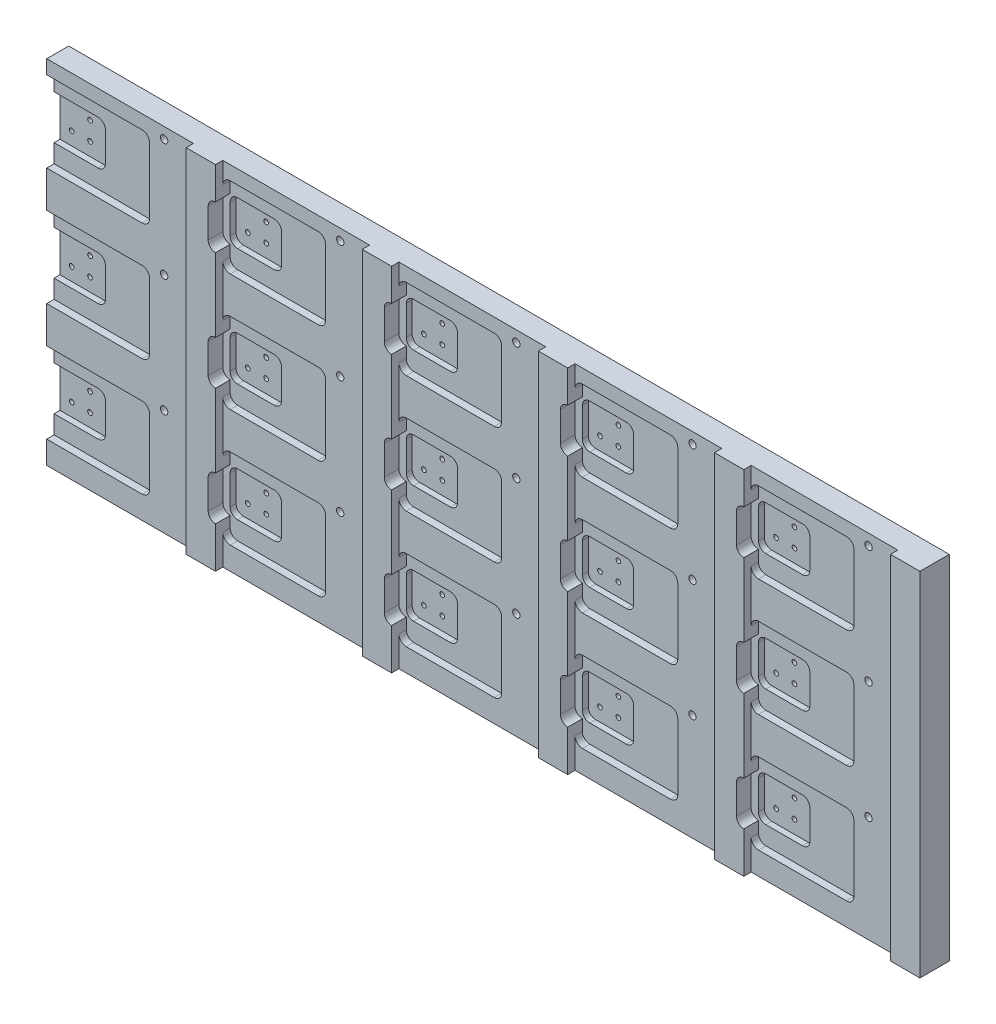
from build123d import *

# Parameters (mm, degrees)
SKETCH1_W              = 762
SKETCH1_H              = 304.8
BOSS_EXTRUDE1_DEPTH    = 25.4
SKETCH4_W              = 127
SKETCH4_H              = 304.8
CUT_EXTRUDE3_DEPTH     = 6.35
SKETCH3_R              = 3.175
CUT_EXTRUDE2_DEPTH     = 15.24
SKETCH5_W              = 88.9
SKETCH5_H              = 69.85
CUT_EXTRUDE4_DEPTH     = 6.35
FILLET1_R              = 6.35
SKETCH6_W              = 44.45
SKETCH6_H              = 38.1
CUT_EXTRUDE5_DEPTH     = 5.08
FILLET2_R              = 6.35
LPATTERN1_COUNT        = 3
LPATTERN1_PITCH        = 101.6
FILLET1_OF_LPATTERN1_R = 6.35
FILLET2_OF_LPATTERN1_R = 6.35
LPATTERN2_START        = 12.7
LPATTERN2_OUTLINE_R    = 3.175
LPATTERN2_DEPTH        = 6.35
LPATTERN2_START_2      = 7.62
LPATTERN2_2_DEPTH      = 5.08
LPATTERN2_START_3      = 10.16
LPATTERN2_3_OUTLINE_R  = 3.175
LPATTERN2_3_DEPTH      = 2.54
FILLET3_R              = 6.35
F_10_32_TAPPED_HOLE1_D = 4.0386
LPATTERN5_COUNT        = 5
LPATTERN5_PITCH        = 152.4
LPATTERN5_COUNT_DIR2   = 3
LPATTERN5_PITCH_DIR2   = 101.6
CUT_EXTRUDE6_START     = -12.7
CUT_EXTRUDE6_DEPTH     = 12.7
LPATTERN6_COUNT        = 4
LPATTERN6_PITCH        = 152.4
LPATTERN6_COUNT_DIR2   = 3
LPATTERN6_PITCH_DIR2   = 101.6


# Read off the part's stored shape, not the designer's step: LPattern2
with BuildPart() as part:
    # Sketch1 → Boss-Extrude1 (new body)
    with BuildSketch(Plane.XY):
        with Locations((381, 152.4)):
            Rectangle(SKETCH1_W, SKETCH1_H)
    extrude(amount=BOSS_EXTRUDE1_DEPTH)

    # Sketch4 → Cut-Extrude3 (cut)
    with BuildSketch(Plane.XY.offset(25.4)):
        with Locations((63.5, 152.4)):
            Rectangle(SKETCH4_W, SKETCH4_H)
        with Locations((215.9, 152.4)):
            Rectangle(SKETCH4_W, SKETCH4_H)
        with Locations((368.3, 152.4)):
            Rectangle(SKETCH4_W, SKETCH4_H)
        with Locations((520.7, 152.4)):
            Rectangle(SKETCH4_W, SKETCH4_H)
        with Locations((673.1, 152.4)):
            Rectangle(SKETCH4_W, SKETCH4_H)
    extrude(amount=-CUT_EXTRUDE3_DEPTH, mode=Mode.SUBTRACT)

    # Sketch3 → Cut-Extrude2 (cut)
    with BuildSketch(Plane.XY.offset(25.4)):
        with Locations((101.6, 295.275)):
            Circle(SKETCH3_R)
    cut_extrude2 = extrude(amount=-CUT_EXTRUDE2_DEPTH, mode=Mode.SUBTRACT)

    # Sketch5 → Cut-Extrude4 (cut)
    with BuildSketch(Plane.XY.offset(19.05)):
        with Locations((44.45, 257.81)):
            Rectangle(SKETCH5_W, SKETCH5_H)
    cut_extrude4 = extrude(amount=-CUT_EXTRUDE4_DEPTH, mode=Mode.SUBTRACT)

    # Fillet1
    fillet1_edges = [part.edges().sort_by_distance(p)[0] for p in [
        (88.9, 292.735, 15.875),
        (88.9, 222.885, 15.875),
    ]]
    fillet(fillet1_edges, radius=FILLET1_R)

    # Sketch6 → Cut-Extrude5 (cut)
    with BuildSketch(Plane.XY.offset(12.7)):
        with Locations((22.225, 257.81)):
            Rectangle(SKETCH6_W, SKETCH6_H)
    cut_extrude5 = extrude(amount=-CUT_EXTRUDE5_DEPTH, mode=Mode.SUBTRACT)

    # Fillet2
    fillet2_edges = [part.edges().sort_by_distance(p)[0] for p in [
        (44.45, 276.86, 10.16),
        (44.45, 238.76, 10.16),
    ]]
    fillet(fillet2_edges, radius=FILLET2_R)

    # LPattern1: Cut-Extrude2, Cut-Extrude4, Cut-Extrude5 ×3
    with Locations(*[(0, -i * LPATTERN1_PITCH, 0) for i in range(1, LPATTERN1_COUNT)]):
        add(cut_extrude2, mode=Mode.SUBTRACT)
        add(cut_extrude4, mode=Mode.SUBTRACT)
        add(cut_extrude5, mode=Mode.SUBTRACT)

    # Fillet1 of LPattern1
    fillet1_of_lpattern1_edges = [part.edges().sort_by_distance(p)[0] for p in [
        (88.9, 191.135, 15.875),
        (88.9, 121.285, 15.875),
        (88.9, 89.535, 15.875),
        (88.9, 19.685, 15.875),
    ]]
    fillet(fillet1_of_lpattern1_edges, radius=FILLET1_OF_LPATTERN1_R)

    # Fillet2 of LPattern1
    fillet2_of_lpattern1_edges = [part.edges().sort_by_distance(p)[0] for p in [
        (44.45, 175.26, 10.16),
        (44.45, 137.16, 10.16),
        (44.45, 73.66, 10.16),
        (44.45, 35.56, 10.16),
    ]]
    fillet(fillet2_of_lpattern1_edges, radius=FILLET2_OF_LPATTERN1_R)

    # LPattern2 outline → LPattern2 (cut)
    with BuildSketch(Plane.XY.offset(LPATTERN2_START)):
        with BuildLine():
            Line((234.95, 292.735), (152.4, 292.735))
            Line((152.4, 292.735), (152.4, 222.885))
            Line((152.4, 222.885), (234.95, 222.885))
            ThreePointArc((234.95, 222.885), (239.440128061, 224.744871939), (241.3, 229.235))
            Line((241.3, 229.235), (241.3, 286.385))
            ThreePointArc((241.3, 286.385), (239.440128061, 290.875128061), (234.95, 292.735))
        make_face()
        with BuildLine():
            Line((234.95, 89.535), (152.4, 89.535))
            Line((152.4, 89.535), (152.4, 19.685))
            Line((152.4, 19.685), (234.95, 19.685))
            ThreePointArc((234.95, 19.685), (239.440128061, 21.544871939), (241.3, 26.035))
            Line((241.3, 26.035), (241.3, 83.185))
            ThreePointArc((241.3, 83.185), (239.440128061, 87.675128061), (234.95, 89.535))
        make_face()
        with BuildLine():
            Line((234.95, 191.135), (152.4, 191.135))
            Line((152.4, 191.135), (152.4, 121.285))
            Line((152.4, 121.285), (234.95, 121.285))
            ThreePointArc((234.95, 121.285), (239.440128061, 123.144871939), (241.3, 127.635))
            Line((241.3, 127.635), (241.3, 184.785))
            ThreePointArc((241.3, 184.785), (239.440128061, 189.275128061), (234.95, 191.135))
        make_face()
        with BuildLine():
            Line((387.35, 292.735), (304.8, 292.735))
            Line((304.8, 292.735), (304.8, 222.885))
            Line((304.8, 222.885), (387.35, 222.885))
            ThreePointArc((387.35, 222.885), (391.840128061, 224.744871939), (393.7, 229.235))
            Line((393.7, 229.235), (393.7, 286.385))
            ThreePointArc((393.7, 286.385), (391.840128061, 290.875128061), (387.35, 292.735))
        make_face()
        with BuildLine():
            Line((387.35, 89.535), (304.8, 89.535))
            Line((304.8, 89.535), (304.8, 19.685))
            Line((304.8, 19.685), (387.35, 19.685))
            ThreePointArc((387.35, 19.685), (391.840128061, 21.544871939), (393.7, 26.035))
            Line((393.7, 26.035), (393.7, 83.185))
            ThreePointArc((393.7, 83.185), (391.840128061, 87.675128061), (387.35, 89.535))
        make_face()
        with BuildLine():
            Line((387.35, 191.135), (304.8, 191.135))
            Line((304.8, 191.135), (304.8, 121.285))
            Line((304.8, 121.285), (387.35, 121.285))
            ThreePointArc((387.35, 121.285), (391.840128061, 123.144871939), (393.7, 127.635))
            Line((393.7, 127.635), (393.7, 184.785))
            ThreePointArc((393.7, 184.785), (391.840128061, 189.275128061), (387.35, 191.135))
        make_face()
        with BuildLine():
            Line((539.75, 292.735), (457.2, 292.735))
            Line((457.2, 292.735), (457.2, 222.885))
            Line((457.2, 222.885), (539.75, 222.885))
            ThreePointArc((539.75, 222.885), (544.240128061, 224.744871939), (546.1, 229.235))
            Line((546.1, 229.235), (546.1, 286.385))
            ThreePointArc((546.1, 286.385), (544.240128061, 290.875128061), (539.75, 292.735))
        make_face()
        with BuildLine():
            Line((539.75, 89.535), (457.2, 89.535))
            Line((457.2, 89.535), (457.2, 19.685))
            Line((457.2, 19.685), (539.75, 19.685))
            ThreePointArc((539.75, 19.685), (544.240128061, 21.544871939), (546.1, 26.035))
            Line((546.1, 26.035), (546.1, 83.185))
            ThreePointArc((546.1, 83.185), (544.240128061, 87.675128061), (539.75, 89.535))
        make_face()
        with BuildLine():
            Line((539.75, 191.135), (457.2, 191.135))
            Line((457.2, 191.135), (457.2, 121.285))
            Line((457.2, 121.285), (539.75, 121.285))
            ThreePointArc((539.75, 121.285), (544.240128061, 123.144871939), (546.1, 127.635))
            Line((546.1, 127.635), (546.1, 184.785))
            ThreePointArc((546.1, 184.785), (544.240128061, 189.275128061), (539.75, 191.135))
        make_face()
        with BuildLine():
            Line((692.15, 292.735), (609.6, 292.735))
            Line((609.6, 292.735), (609.6, 222.885))
            Line((609.6, 222.885), (692.15, 222.885))
            ThreePointArc((692.15, 222.885), (696.640128061, 224.744871939), (698.5, 229.235))
            Line((698.5, 229.235), (698.5, 286.385))
            ThreePointArc((698.5, 286.385), (696.640128061, 290.875128061), (692.15, 292.735))
        make_face()
        with BuildLine():
            Line((692.15, 89.535), (609.6, 89.535))
            Line((609.6, 89.535), (609.6, 19.685))
            Line((609.6, 19.685), (692.15, 19.685))
            ThreePointArc((692.15, 19.685), (696.640128061, 21.544871939), (698.5, 26.035))
            Line((698.5, 26.035), (698.5, 83.185))
            ThreePointArc((698.5, 83.185), (696.640128061, 87.675128061), (692.15, 89.535))
        make_face()
        with BuildLine():
            Line((692.15, 191.135), (609.6, 191.135))
            Line((609.6, 191.135), (609.6, 121.285))
            Line((609.6, 121.285), (692.15, 121.285))
            ThreePointArc((692.15, 121.285), (696.640128061, 123.144871939), (698.5, 127.635))
            Line((698.5, 127.635), (698.5, 184.785))
            ThreePointArc((698.5, 184.785), (696.640128061, 189.275128061), (692.15, 191.135))
        make_face()
        with Locations((254, 295.275)):
            Circle(LPATTERN2_OUTLINE_R)
        with Locations((254, 193.675)):
            Circle(LPATTERN2_OUTLINE_R)
        with Locations((254, 92.075)):
            Circle(LPATTERN2_OUTLINE_R)
        with Locations((406.4, 295.275)):
            Circle(LPATTERN2_OUTLINE_R)
        with Locations((406.4, 193.675)):
            Circle(LPATTERN2_OUTLINE_R)
        with Locations((406.4, 92.075)):
            Circle(LPATTERN2_OUTLINE_R)
        with Locations((558.8, 295.275)):
            Circle(LPATTERN2_OUTLINE_R)
        with Locations((558.8, 193.675)):
            Circle(LPATTERN2_OUTLINE_R)
        with Locations((558.8, 92.075)):
            Circle(LPATTERN2_OUTLINE_R)
        with Locations((711.2, 295.275)):
            Circle(LPATTERN2_OUTLINE_R)
        with Locations((711.2, 193.675)):
            Circle(LPATTERN2_OUTLINE_R)
        with Locations((711.2, 92.075)):
            Circle(LPATTERN2_OUTLINE_R)
    extrude(amount=LPATTERN2_DEPTH, mode=Mode.SUBTRACT)

    # LPattern2 2 outline → LPattern2 2 (cut)
    with BuildSketch(Plane.XY.offset(LPATTERN2_START_2)):
        with BuildLine():
            Line((190.5, 276.86), (152.4, 276.86))
            Line((152.4, 276.86), (152.4, 238.76))
            Line((152.4, 238.76), (190.5, 238.76))
            ThreePointArc((190.5, 238.76), (194.990128061, 240.619871939), (196.85, 245.11))
            Line((196.85, 245.11), (196.85, 270.51))
            ThreePointArc((196.85, 270.51), (194.990128061, 275.000128061), (190.5, 276.86))
        make_face()
        with BuildLine():
            Line((190.5, 175.26), (152.4, 175.26))
            Line((152.4, 175.26), (152.4, 137.16))
            Line((152.4, 137.16), (190.5, 137.16))
            ThreePointArc((190.5, 137.16), (194.990128061, 139.019871939), (196.85, 143.51))
            Line((196.85, 143.51), (196.85, 168.91))
            ThreePointArc((196.85, 168.91), (194.990128061, 173.400128061), (190.5, 175.26))
        make_face()
        with BuildLine():
            Line((190.5, 73.66), (152.4, 73.66))
            Line((152.4, 73.66), (152.4, 35.56))
            Line((152.4, 35.56), (190.5, 35.56))
            ThreePointArc((190.5, 35.56), (194.990128061, 37.419871939), (196.85, 41.91))
            Line((196.85, 41.91), (196.85, 67.31))
            ThreePointArc((196.85, 67.31), (194.990128061, 71.800128061), (190.5, 73.66))
        make_face()
        with BuildLine():
            Line((342.9, 276.86), (304.8, 276.86))
            Line((304.8, 276.86), (304.8, 238.76))
            Line((304.8, 238.76), (342.9, 238.76))
            ThreePointArc((342.9, 238.76), (347.390128061, 240.619871939), (349.25, 245.11))
            Line((349.25, 245.11), (349.25, 270.51))
            ThreePointArc((349.25, 270.51), (347.390128061, 275.000128061), (342.9, 276.86))
        make_face()
        with BuildLine():
            Line((342.9, 175.26), (304.8, 175.26))
            Line((304.8, 175.26), (304.8, 137.16))
            Line((304.8, 137.16), (342.9, 137.16))
            ThreePointArc((342.9, 137.16), (347.390128061, 139.019871939), (349.25, 143.51))
            Line((349.25, 143.51), (349.25, 168.91))
            ThreePointArc((349.25, 168.91), (347.390128061, 173.400128061), (342.9, 175.26))
        make_face()
        with BuildLine():
            Line((342.9, 73.66), (304.8, 73.66))
            Line((304.8, 73.66), (304.8, 35.56))
            Line((304.8, 35.56), (342.9, 35.56))
            ThreePointArc((342.9, 35.56), (347.390128061, 37.419871939), (349.25, 41.91))
            Line((349.25, 41.91), (349.25, 67.31))
            ThreePointArc((349.25, 67.31), (347.390128061, 71.800128061), (342.9, 73.66))
        make_face()
        with BuildLine():
            Line((495.3, 276.86), (457.2, 276.86))
            Line((457.2, 276.86), (457.2, 238.76))
            Line((457.2, 238.76), (495.3, 238.76))
            ThreePointArc((495.3, 238.76), (499.790128061, 240.619871939), (501.65, 245.11))
            Line((501.65, 245.11), (501.65, 270.51))
            ThreePointArc((501.65, 270.51), (499.790128061, 275.000128061), (495.3, 276.86))
        make_face()
        with BuildLine():
            Line((495.3, 175.26), (457.2, 175.26))
            Line((457.2, 175.26), (457.2, 137.16))
            Line((457.2, 137.16), (495.3, 137.16))
            ThreePointArc((495.3, 137.16), (499.790128061, 139.019871939), (501.65, 143.51))
            Line((501.65, 143.51), (501.65, 168.91))
            ThreePointArc((501.65, 168.91), (499.790128061, 173.400128061), (495.3, 175.26))
        make_face()
        with BuildLine():
            Line((495.3, 73.66), (457.2, 73.66))
            Line((457.2, 73.66), (457.2, 35.56))
            Line((457.2, 35.56), (495.3, 35.56))
            ThreePointArc((495.3, 35.56), (499.790128061, 37.419871939), (501.65, 41.91))
            Line((501.65, 41.91), (501.65, 67.31))
            ThreePointArc((501.65, 67.31), (499.790128061, 71.800128061), (495.3, 73.66))
        make_face()
        with BuildLine():
            Line((647.7, 276.86), (609.6, 276.86))
            Line((609.6, 276.86), (609.6, 238.76))
            Line((609.6, 238.76), (647.7, 238.76))
            ThreePointArc((647.7, 238.76), (652.190128061, 240.619871939), (654.05, 245.11))
            Line((654.05, 245.11), (654.05, 270.51))
            ThreePointArc((654.05, 270.51), (652.190128061, 275.000128061), (647.7, 276.86))
        make_face()
        with BuildLine():
            Line((647.7, 175.26), (609.6, 175.26))
            Line((609.6, 175.26), (609.6, 137.16))
            Line((609.6, 137.16), (647.7, 137.16))
            ThreePointArc((647.7, 137.16), (652.190128061, 139.019871939), (654.05, 143.51))
            Line((654.05, 143.51), (654.05, 168.91))
            ThreePointArc((654.05, 168.91), (652.190128061, 173.400128061), (647.7, 175.26))
        make_face()
        with BuildLine():
            Line((647.7, 73.66), (609.6, 73.66))
            Line((609.6, 73.66), (609.6, 35.56))
            Line((609.6, 35.56), (647.7, 35.56))
            ThreePointArc((647.7, 35.56), (652.190128061, 37.419871939), (654.05, 41.91))
            Line((654.05, 41.91), (654.05, 67.31))
            ThreePointArc((654.05, 67.31), (652.190128061, 71.800128061), (647.7, 73.66))
        make_face()
    extrude(amount=LPATTERN2_2_DEPTH, mode=Mode.SUBTRACT)

    # LPattern2 3 outline → LPattern2 3 (cut)
    with BuildSketch(Plane.XY.offset(LPATTERN2_START_3)):
        with Locations((254, 295.275)):
            Circle(LPATTERN2_3_OUTLINE_R)
        with Locations((254, 193.675)):
            Circle(LPATTERN2_3_OUTLINE_R)
        with Locations((254, 92.075)):
            Circle(LPATTERN2_3_OUTLINE_R)
        with Locations((406.4, 295.275)):
            Circle(LPATTERN2_3_OUTLINE_R)
        with Locations((406.4, 193.675)):
            Circle(LPATTERN2_3_OUTLINE_R)
        with Locations((406.4, 92.075)):
            Circle(LPATTERN2_3_OUTLINE_R)
        with Locations((558.8, 295.275)):
            Circle(LPATTERN2_3_OUTLINE_R)
        with Locations((558.8, 193.675)):
            Circle(LPATTERN2_3_OUTLINE_R)
        with Locations((558.8, 92.075)):
            Circle(LPATTERN2_3_OUTLINE_R)
        with Locations((711.2, 295.275)):
            Circle(LPATTERN2_3_OUTLINE_R)
        with Locations((711.2, 193.675)):
            Circle(LPATTERN2_3_OUTLINE_R)
        with Locations((711.2, 92.075)):
            Circle(LPATTERN2_3_OUTLINE_R)
    extrude(amount=LPATTERN2_3_DEPTH, mode=Mode.SUBTRACT)

    # Fillet3
    fillet3_edges = [part.edges().sort_by_distance(p)[0] for p in [
        (152.4, 222.885, 15.875),
        (152.4, 292.735, 15.875),
        (152.4, 121.285, 15.875),
        (152.4, 191.135, 15.875),
        (152.4, 19.685, 15.875),
        (152.4, 89.535, 15.875),
        (152.4, 238.76, 10.16),
        (152.4, 276.86, 10.16),
        (152.4, 137.16, 10.16),
        (152.4, 175.26, 10.16),
        (152.4, 35.56, 10.16),
        (152.4, 73.66, 10.16),
        (304.8, 222.885, 15.875),
        (304.8, 292.735, 15.875),
        (304.8, 121.285, 15.875),
        (304.8, 191.135, 15.875),
        (304.8, 19.685, 15.875),
        (304.8, 89.535, 15.875),
        (304.8, 238.76, 10.16),
        (304.8, 276.86, 10.16),
        (304.8, 137.16, 10.16),
        (304.8, 175.26, 10.16),
        (304.8, 35.56, 10.16),
        (304.8, 73.66, 10.16),
        (457.2, 222.885, 15.875),
        (457.2, 292.735, 15.875),
        (457.2, 121.285, 15.875),
        (457.2, 191.135, 15.875),
        (457.2, 19.685, 15.875),
        (457.2, 89.535, 15.875),
        (457.2, 238.76, 10.16),
        (457.2, 276.86, 10.16),
        (457.2, 137.16, 10.16),
        (457.2, 175.26, 10.16),
        (457.2, 35.56, 10.16),
        (457.2, 73.66, 10.16),
        (609.6, 222.885, 15.875),
        (609.6, 292.735, 15.875),
        (609.6, 121.285, 15.875),
        (609.6, 191.135, 15.875),
        (609.6, 19.685, 15.875),
        (609.6, 89.535, 15.875),
        (609.6, 238.76, 10.16),
        (609.6, 276.86, 10.16),
        (609.6, 137.16, 10.16),
        (609.6, 175.26, 10.16),
        (609.6, 35.56, 10.16),
        (609.6, 73.66, 10.16),
    ]]
    fillet(fillet3_edges, radius=FILLET3_R)

    # #10-32 Tapped Hole1 (through all)
    with Locations(Plane.XY.offset(7.62)):
        with Locations((26.035, 250.143692008), (10.1346, 250.143692008), (26.035, 266.044092008)):
            f_10_32_tapped_hole1 = Hole(F_10_32_TAPPED_HOLE1_D / 2)

    # LPattern5: 10-32 Tapped Hole1 5 × 3
    with Locations(*[(i * LPATTERN5_PITCH, -j * LPATTERN5_PITCH_DIR2, 0) for i in range(LPATTERN5_COUNT) for j in range(LPATTERN5_COUNT_DIR2) if (i, j) != (0, 0)]):
        add(f_10_32_tapped_hole1, mode=Mode.SUBTRACT)

    # Sketch10 → Cut-Extrude6 (cut)
    with BuildSketch(Plane.XY.offset(25.4).offset(CUT_EXTRUDE6_START)):
        with BuildLine():
            Line((158.75, 276.86), (152.4, 276.86))
            ThreePointArc((152.4, 276.86), (147.909871939, 275.000128061), (146.05, 270.51))
            Line((146.05, 270.51), (146.05, 245.11))
            ThreePointArc((146.05, 245.11), (147.909871939, 240.619871939), (152.4, 238.76))
            Line((152.4, 238.76), (158.75, 238.76))
            Line((158.75, 238.76), (158.75, 276.86))
        make_face()
    cut_extrude6 = extrude(amount=CUT_EXTRUDE6_DEPTH, mode=Mode.SUBTRACT)

    # LPattern6: Cut-Extrude6 4 × 3
    with Locations(*[(i * LPATTERN6_PITCH, -j * LPATTERN6_PITCH_DIR2, 0) for i in range(LPATTERN6_COUNT) for j in range(LPATTERN6_COUNT_DIR2) if (i, j) != (0, 0)]):
        add(cut_extrude6, mode=Mode.SUBTRACT)


solid = part.part
